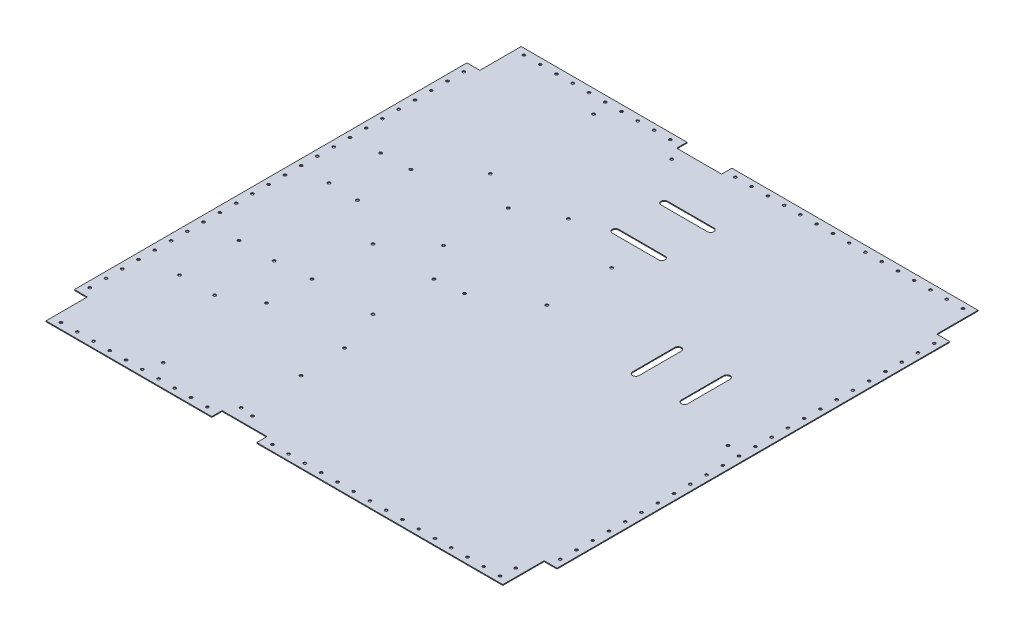
from build123d import *

# Parameters (mm, degrees)
SKETCH1_W          = 914.4
SKETCH1_H          = 609.6
BASE_FLANGE1_DEPTH = 1.016
SKETCH6_OUTSIDE_W  = 1136.194
SKETCH6_OUTSIDE_H  = 831.394
CUT_EXTRUDE1_DEPTH = 10
SKETCH8_R          = 1.675
SKETCH8_R_2        = 1.632505584
CUT_EXTRUDE2_DEPTH = 962.765867301
CUT_EXTRUDE3_DEPTH = 962.765867301
SKETCH14_R         = 1.750000001
SKETCH14_R_2       = 1.75
CUT_EXTRUDE4_DEPTH = 962.765867301


# Sheet-metal steps are written as plain solids
with BuildPart() as part:
    # Sketch1 → Base-Flange1 (new body)
    with BuildSketch(Plane(origin=(0, 0, 0), x_dir=(1, 0, 0), z_dir=(0, 1, 0))):
        with Locations((457.2, 304.8)):
            Rectangle(SKETCH1_W, SKETCH1_H)
    extrude(amount=-BASE_FLANGE1_DEPTH)

    # Sketch6 outside → Cut-Extrude1 (cut)
    with BuildSketch(Plane(origin=(0, 0, 0), x_dir=(1, 0, 0), z_dir=(0, 1, 0))):
        with Locations((457.2, 304.8)):
            Rectangle(SKETCH6_OUTSIDE_W, SKETCH6_OUTSIDE_H)
        Polygon((176.255, 597.025), (380.175, 597.025), (380.175, 584.325), (435.475, 584.325), (435.475, 597.025), (738.145, 597.025), (738.145, 546.225), (754.025, 546.225), (754.025, 63.375), (738.145, 63.375), (738.145, 12.575), (435.475, 12.575), (435.475, 25.275), (380.175, 25.275), (380.175, 12.575), (176.255, 12.575), (176.255, 63.375), (160.375, 63.375), (160.375, 546.225), (176.255, 546.225), align=None, mode=Mode.SUBTRACT)
    extrude(amount=-CUT_EXTRUDE1_DEPTH, mode=Mode.SUBTRACT)

    # Sketch8 → Cut-Extrude2 (cut, through all)
    with BuildSketch(Plane.XZ.offset(1.016)):
        with Locations(Location((167.875, -534.8, 0), (0, 0, 270))):
            Circle(SKETCH8_R)
        with Locations(Location((167.875, -514.8, 0), (0, 0, 270))):
            Circle(SKETCH8_R)
        with Locations(Location((167.875, -494.8, 0), (0, 0, 270))):
            Circle(SKETCH8_R)
        with Locations(Location((167.875, -474.8, 0), (0, 0, 270))):
            Circle(SKETCH8_R)
        with Locations(Location((167.875, -454.8, 0), (0, 0, 270))):
            Circle(SKETCH8_R)
        with Locations(Location((167.875, -434.8, 0), (0, 0, 270))):
            Circle(SKETCH8_R)
        with Locations(Location((167.875, -414.8, 0), (0, 0, 270))):
            Circle(SKETCH8_R)
        with Locations(Location((167.875, -394.8, 0), (0, 0, 270))):
            Circle(SKETCH8_R)
        with Locations(Location((167.875, -374.8, 0), (0, 0, 270))):
            Circle(SKETCH8_R)
        with Locations(Location((167.875, -354.8, 0), (0, 0, 270))):
            Circle(SKETCH8_R)
        with Locations(Location((167.875, -334.8, 0), (0, 0, 270))):
            Circle(SKETCH8_R)
        with Locations(Location((167.875, -314.8, 0), (0, 0, 270))):
            Circle(SKETCH8_R)
        with Locations(Location((167.875, -294.8, 0), (0, 0, 270))):
            Circle(SKETCH8_R)
        with Locations(Location((167.875, -274.8, 0), (0, 0, 270))):
            Circle(SKETCH8_R)
        with Locations(Location((167.875, -254.8, 0), (0, 0, 270))):
            Circle(SKETCH8_R)
        with Locations(Location((167.875, -234.8, 0), (0, 0, 270))):
            Circle(SKETCH8_R)
        with Locations(Location((167.875, -214.8, 0), (0, 0, 270))):
            Circle(SKETCH8_R)
        with Locations(Location((167.875, -194.8, 0), (0, 0, 270))):
            Circle(SKETCH8_R)
        with Locations(Location((167.875, -174.8, 0), (0, 0, 270))):
            Circle(SKETCH8_R)
        with Locations(Location((167.875, -154.8, 0), (0, 0, 270))):
            Circle(SKETCH8_R)
        with Locations(Location((167.875, -134.8, 0), (0, 0, 270))):
            Circle(SKETCH8_R)
        with Locations(Location((167.875, -114.8, 0), (0, 0, 270))):
            Circle(SKETCH8_R)
        with Locations(Location((167.875, -94.8, 0), (0, 0, 270))):
            Circle(SKETCH8_R)
        with Locations(Location((167.875, -74.8, 0), (0, 0, 270))):
            Circle(SKETCH8_R)
        with Locations(Location((187.2, -20.075, 0), (0, 0, 270))):
            Circle(SKETCH8_R)
        with Locations(Location((207.2, -20.075, 0), (0, 0, 270))):
            Circle(SKETCH8_R)
        with Locations(Location((227.2, -20.075, 0), (0, 0, 270))):
            Circle(SKETCH8_R)
        with Locations(Location((247.2, -20.075, 0), (0, 0, 270))):
            Circle(SKETCH8_R)
        with Locations(Location((267.2, -20.075, 0), (0, 0, 270))):
            Circle(SKETCH8_R)
        with Locations(Location((287.2, -20.075, 0), (0, 0, 270))):
            Circle(SKETCH8_R)
        with Locations(Location((307.2, -20.075, 0), (0, 0, 270))):
            Circle(SKETCH8_R)
        with Locations(Location((327.2, -20.075, 0), (0, 0, 270))):
            Circle(SKETCH8_R)
        with Locations(Location((347.2, -20.075, 0), (0, 0, 270))):
            Circle(SKETCH8_R)
        with Locations(Location((367.2, -20.075, 0), (0, 0, 270))):
            Circle(SKETCH8_R)
        with Locations(Location((447.2, -20.075, 0), (0, 0, 270))):
            Circle(SKETCH8_R)
        with Locations(Location((467.2, -20.075, 0), (0, 0, 270))):
            Circle(SKETCH8_R)
        with Locations(Location((487.2, -20.075, 0), (0, 0, 270))):
            Circle(SKETCH8_R)
        with Locations(Location((507.2, -20.075, 0), (0, 0, 270))):
            Circle(SKETCH8_R)
        with Locations(Location((527.2, -20.075, 0), (0, 0, 270))):
            Circle(SKETCH8_R)
        with Locations(Location((547.2, -20.075, 0), (0, 0, 270))):
            Circle(SKETCH8_R)
        with Locations(Location((567.2, -20.075, 0), (0, 0, 270))):
            Circle(SKETCH8_R)
        with Locations(Location((587.2, -20.075, 0), (0, 0, 270))):
            Circle(SKETCH8_R)
        with Locations(Location((607.2, -20.075, 0), (0, 0, 270))):
            Circle(SKETCH8_R)
        with Locations(Location((627.2, -20.075, 0), (0, 0, 270))):
            Circle(SKETCH8_R)
        with Locations(Location((647.2, -20.075, 0), (0, 0, 270))):
            Circle(SKETCH8_R)
        with Locations(Location((667.2, -20.075, 0), (0, 0, 270))):
            Circle(SKETCH8_R)
        with Locations(Location((687.2, -20.075, 0), (0, 0, 270))):
            Circle(SKETCH8_R)
        with Locations(Location((707.2, -20.075, 0), (0, 0, 270))):
            Circle(SKETCH8_R)
        with Locations(Location((727.2, -20.075, 0), (0, 0, 270))):
            Circle(SKETCH8_R)
        with Locations(Location((746.525, -74.8, 0), (0, 0, 270))):
            Circle(SKETCH8_R)
        with Locations(Location((746.525, -94.8, 0), (0, 0, 270))):
            Circle(SKETCH8_R)
        with Locations(Location((746.525, -114.8, 0), (0, 0, 270))):
            Circle(SKETCH8_R)
        with Locations(Location((746.525, -134.8, 0), (0, 0, 270))):
            Circle(SKETCH8_R)
        with Locations(Location((746.525, -154.8, 0), (0, 0, 270))):
            Circle(SKETCH8_R)
        with Locations(Location((746.525, -174.8, 0), (0, 0, 270))):
            Circle(SKETCH8_R)
        with Locations(Location((746.525, -194.8, 0), (0, 0, 270))):
            Circle(SKETCH8_R)
        with Locations(Location((746.525, -214.8, 0), (0, 0, 270))):
            Circle(SKETCH8_R)
        with Locations(Location((746.525, -234.8, 0), (0, 0, 270))):
            Circle(SKETCH8_R)
        with Locations(Location((746.525, -254.8, 0), (0, 0, 270))):
            Circle(SKETCH8_R)
        with Locations(Location((746.525, -274.8, 0), (0, 0, 270))):
            Circle(SKETCH8_R)
        with Locations(Location((746.525, -294.8, 0), (0, 0, 270))):
            Circle(SKETCH8_R)
        with Locations(Location((746.525, -314.8, 0), (0, 0, 270))):
            Circle(SKETCH8_R)
        with Locations(Location((746.525, -334.8, 0), (0, 0, 270))):
            Circle(SKETCH8_R)
        with Locations(Location((746.525, -354.8, 0), (0, 0, 270))):
            Circle(SKETCH8_R)
        with Locations(Location((746.525, -374.8, 0), (0, 0, 270))):
            Circle(SKETCH8_R)
        with Locations(Location((746.525, -394.8, 0), (0, 0, 270))):
            Circle(SKETCH8_R)
        with Locations(Location((746.525, -414.8, 0), (0, 0, 270))):
            Circle(SKETCH8_R)
        with Locations(Location((746.525, -434.8, 0), (0, 0, 270))):
            Circle(SKETCH8_R)
        with Locations(Location((746.525, -454.8, 0), (0, 0, 270))):
            Circle(SKETCH8_R)
        with Locations(Location((746.525, -474.8, 0), (0, 0, 270))):
            Circle(SKETCH8_R)
        with Locations(Location((746.525, -494.8, 0), (0, 0, 270))):
            Circle(SKETCH8_R)
        with Locations(Location((746.525, -514.8, 0), (0, 0, 270))):
            Circle(SKETCH8_R)
        with Locations(Location((746.525, -534.8, 0), (0, 0, 270))):
            Circle(SKETCH8_R)
        with Locations(Location((727.2, -589.525, 0), (0, 0, 270))):
            Circle(SKETCH8_R)
        with Locations(Location((707.2, -589.525, 0), (0, 0, 270))):
            Circle(SKETCH8_R)
        with Locations(Location((687.2, -589.525, 0), (0, 0, 270))):
            Circle(SKETCH8_R)
        with Locations(Location((667.2, -589.525, 0), (0, 0, 270))):
            Circle(SKETCH8_R)
        with Locations(Location((647.2, -589.525, 0), (0, 0, 270))):
            Circle(SKETCH8_R)
        with Locations(Location((627.2, -589.525, 0), (0, 0, 270))):
            Circle(SKETCH8_R)
        with Locations(Location((607.2, -589.525, 0), (0, 0, 270))):
            Circle(SKETCH8_R)
        with Locations(Location((587.2, -589.525, 0), (0, 0, 270))):
            Circle(SKETCH8_R)
        with Locations(Location((567.2, -589.525, 0), (0, 0, 270))):
            Circle(SKETCH8_R)
        with Locations(Location((547.2, -589.525, 0), (0, 0, 270))):
            Circle(SKETCH8_R)
        with Locations(Location((527.2, -589.525, 0), (0, 0, 270))):
            Circle(SKETCH8_R)
        with Locations(Location((507.2, -589.525, 0), (0, 0, 270))):
            Circle(SKETCH8_R)
        with Locations(Location((487.2, -589.525, 0), (0, 0, 270))):
            Circle(SKETCH8_R)
        with Locations(Location((467.2, -589.525, 0), (0, 0, 270))):
            Circle(SKETCH8_R)
        with Locations(Location((447.2, -589.525, 0), (0, 0, 270))):
            Circle(SKETCH8_R)
        with Locations(Location((367.2, -589.525, 0), (0, 0, 270))):
            Circle(SKETCH8_R)
        with Locations(Location((347.2, -589.525, 0), (0, 0, 270))):
            Circle(SKETCH8_R)
        with Locations(Location((327.2, -589.525, 0), (0, 0, 270))):
            Circle(SKETCH8_R)
        with Locations(Location((307.2, -589.525, 0), (0, 0, 270))):
            Circle(SKETCH8_R)
        with Locations(Location((287.2, -589.525, 0), (0, 0, 270))):
            Circle(SKETCH8_R)
        with Locations(Location((267.2, -589.525, 0), (0, 0, 270))):
            Circle(SKETCH8_R)
        with Locations(Location((247.2, -589.525, 0), (0, 0, 270))):
            Circle(SKETCH8_R)
        with Locations(Location((227.2, -589.525, 0), (0, 0, 270))):
            Circle(SKETCH8_R)
        with Locations(Location((207.2, -589.525, 0), (0, 0, 270))):
            Circle(SKETCH8_R)
        with Locations(Location((187.2, -589.525, 0), (0, 0, 270))):
            Circle(SKETCH8_R_2)
    extrude(amount=-CUT_EXTRUDE2_DEPTH, mode=Mode.SUBTRACT)

    # Sketch11 → Cut-Extrude3 (cut, through all)
    with BuildSketch(Plane(origin=(0, 0, 0), x_dir=(1, 0, 0), z_dir=(0, 1, 0))):
        with BuildLine():
            Line((599.275, 371.025), (599.275, 319.025))
            ThreePointArc((599.275, 319.025), (595.275, 315.025), (591.275, 319.025))
            Line((591.275, 319.025), (591.275, 371.025))
            ThreePointArc((591.275, 371.025), (595.275, 375.025), (599.275, 371.025))
        make_face()
        with BuildLine():
            Line((659.275, 371.025), (659.275, 319.025))
            ThreePointArc((659.275, 319.025), (655.275, 315.025), (651.275, 319.025))
            Line((651.275, 319.025), (651.275, 371.025))
            ThreePointArc((651.275, 371.025), (655.275, 375.025), (659.275, 371.025))
        make_face()
        with BuildLine():
            Line((488.025, 454.275), (431.025, 454.275))
            ThreePointArc((431.025, 454.275), (427.025, 458.275), (431.025, 462.275))
            Line((431.025, 462.275), (488.025, 462.275))
            ThreePointArc((488.025, 462.275), (492.025, 458.275), (488.025, 454.275))
        make_face()
        with BuildLine():
            Line((488.025, 514.275), (431.025, 514.275))
            ThreePointArc((431.025, 514.275), (427.025, 518.275), (431.025, 522.275))
            Line((431.025, 522.275), (488.025, 522.275))
            ThreePointArc((488.025, 522.275), (492.025, 518.275), (488.025, 514.275))
        make_face()
    extrude(amount=-CUT_EXTRUDE3_DEPTH, mode=Mode.SUBTRACT)

    # Sketch14 → Cut-Extrude4 (cut, through all)
    with BuildSketch(Plane(origin=(0, 0, 0), x_dir=(1, 0, 0), z_dir=(0, 1, 0))):
        with Locations(Location((203.375, 333.575, 0), (0, 0, 270))):
            Circle(SKETCH14_R)
        with Locations(Location((203.375, 397.175, 0), (0, 0, 270))):
            Circle(SKETCH14_R)
        with Locations(Location((239.375, 332.575, 0), (0, 0, 270))):
            Circle(SKETCH14_R)
        with Locations(Location((239.375, 398.175, 0), (0, 0, 270))):
            Circle(SKETCH14_R)
        with Locations(Location((295.375, 220.575, 0), (0, 0, 270))):
            Circle(SKETCH14_R)
        with Locations(Location((295.375, 295.575, 0), (0, 0, 270))):
            Circle(SKETCH14_R)
        with Locations(Location((370.375, 220.575, 0), (0, 0, 270))):
            Circle(SKETCH14_R)
        with Locations(Location((370.375, 295.575, 0), (0, 0, 270))):
            Circle(SKETCH14_R)
        with Locations(Location((292.875, 442.525, 0), (0, 0, 270))):
            Circle(SKETCH14_R)
        with Locations(Location((292.875, 569.525, 0), (0, 0, 270))):
            Circle(SKETCH14_R)
        with Locations(Location((388.875, 569.525, 0), (0, 0, 270))):
            Circle(SKETCH14_R)
        with Locations(Location((388.875, 442.525, 0), (0, 0, 270))):
            Circle(SKETCH14_R)
        with Locations(Location((252.678260738, 143.580438588, 0), (0, 0, 270))):
            Circle(SKETCH14_R)
        with Locations(Location((252.678260738, 216.780438588, 0), (0, 0, 270))):
            Circle(SKETCH14_R)
        with Locations(Location((209.478260738, 216.780438588, 0), (0, 0, 270))):
            Circle(SKETCH14_R)
        with Locations(Location((209.478260738, 143.580438588, 0), (0, 0, 270))):
            Circle(SKETCH14_R)
        with Locations(Location((292.875, 167.075, 0), (0, 0, 270))):
            Circle(SKETCH14_R)
        with Locations(Location((292.875, 40.075, 0), (0, 0, 270))):
            Circle(SKETCH14_R)
        with Locations(Location((388.875, 40.075, 0), (0, 0, 270))):
            Circle(SKETCH14_R)
        with Locations(Location((391.544931419, 111.055068581, 0), (0, 0, 270))):
            Circle(SKETCH14_R)
        with Locations(Location((388.875, 167.075, 0), (0, 0, 270))):
            Circle(SKETCH14_R)
        with Locations(Location((404.525, 299.075, 0), (0, 0, 270))):
            Circle(SKETCH14_R)
        with Locations(Location((404.525, 38.075, 0), (0, 0, 270))):
            Circle(SKETCH14_R)
        with Locations(Location((728.525, 38.075, 0), (0, 0, 270))):
            Circle(SKETCH14_R)
        with Locations(Location((728.525, 299.075, 0), (0, 0, 270))):
            Circle(SKETCH14_R)
        with Locations(Location((340.375, 417.025, 0), (0, 0, 270))):
            Circle(SKETCH14_R_2)
        with Locations(Location((340.375, 337.35, 0), (0, 0, 270))):
            Circle(SKETCH14_R_2)
        with Locations(Location((467.675, 337.35, 0), (0, 0, 270))):
            Circle(SKETCH14_R_2)
        with Locations(Location((467.675, 417.025, 0), (0, 0, 270))):
            Circle(SKETCH14_R_2)
    extrude(amount=-CUT_EXTRUDE4_DEPTH, mode=Mode.SUBTRACT)


solid = part.part
